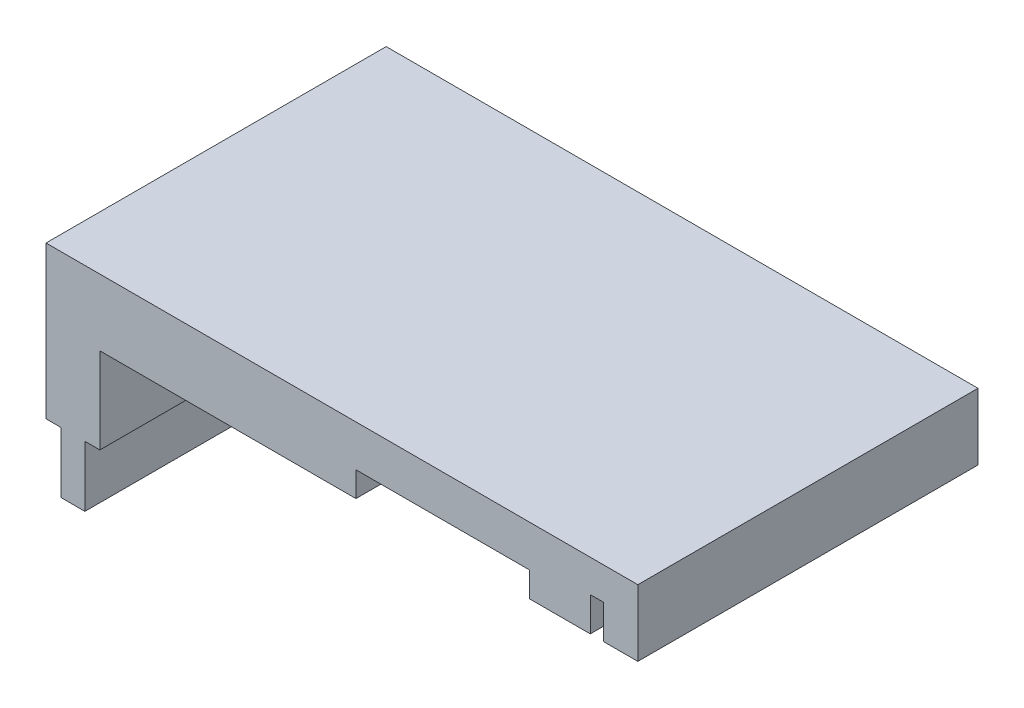
from build123d import *

# Parameters (mm, degrees)
BOSS_EXTRUDE1_DEPTH = 95.25
SKETCH3_W           = 9
SKETCH3_H           = 41.03
CUT_EXTRUDE1_DEPTH  = 183.880891019
SKETCH4_R           = 1.03
CUT_EXTRUDE2_DEPTH  = 3


with BuildPart() as part:
    # Sketch1 → Boss-Extrude1 (new body)
    with BuildSketch(Plane.XY):
        Polygon((0, 0), (0, 18.61), (-165.72, 18.61), (-165.72, -24.03), (-161.52, -24.03), (-161.52, -41.03), (-154.83, -41.03), (-154.83, -24.03), (-150.63, -24.03), (-150.63, 0.01), (-78.94, 0.01), (-78.94, 7.01), (-30.27, 7.01), (-30.27, 0.01), (-13.32, 0.01), (-13.32, 9.54), (-9.63, 9.54), (-9.63, 0), align=None)
    extrude(amount=BOSS_EXTRUDE1_DEPTH)

    # Sketch3 → Cut-Extrude1 (cut, through all)
    with BuildSketch(Plane(origin=(-150.63, 0, 0), x_dir=(0, 0, -1), z_dir=(1, 0, 0))):
        with Locations((-4.5, -20.515)):
            Rectangle(SKETCH3_W, SKETCH3_H)
    extrude(amount=-CUT_EXTRUDE1_DEPTH, mode=Mode.SUBTRACT)

    # Sketch4 → Cut-Extrude2 (cut)
    with BuildSketch(Plane.XZ.offset(-7.01)):
        with Locations((-69.08, 42.44)):
            Circle(SKETCH4_R)
        with Locations((-49.58, 60.2)):
            Circle(SKETCH4_R)
    extrude(amount=-CUT_EXTRUDE2_DEPTH, mode=Mode.SUBTRACT)


solid = part.part
